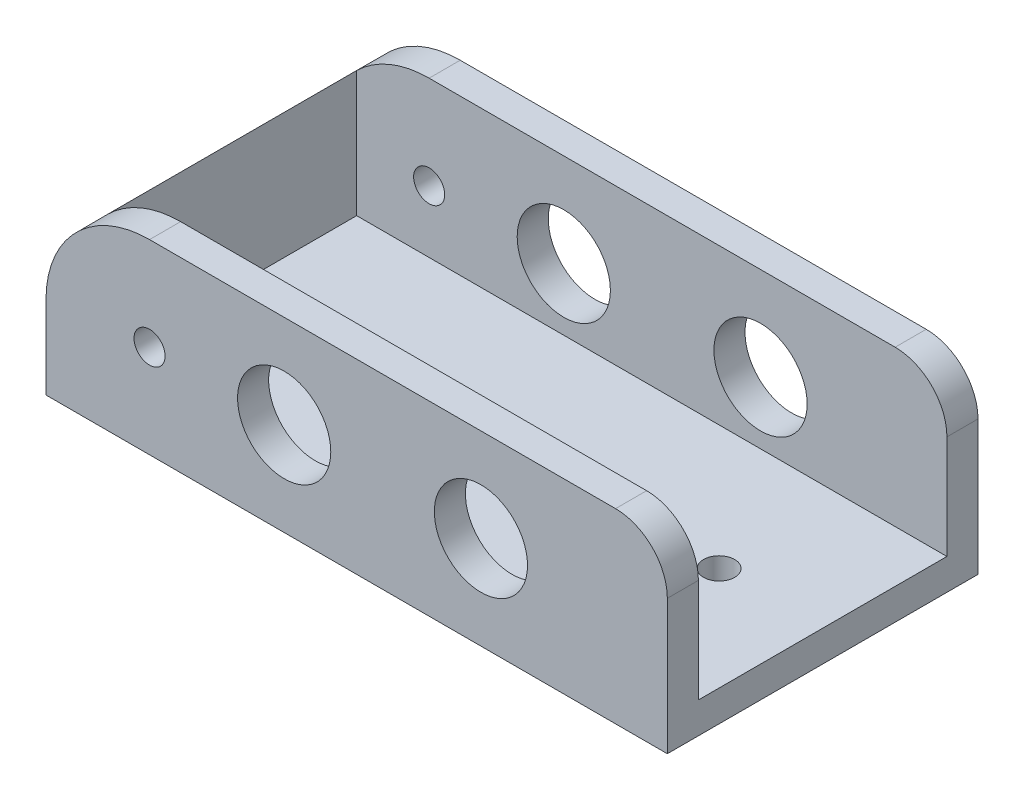
from build123d import *

# Parameters (mm, degrees)
CROQUIS1_W              = 60
CROQUIS1_H              = 30
CROQUIS1_R              = 1.5
SALIENTE_EXTRUIR1_DEPTH = 3
SALIENTE_EXTRUIR2_DEPTH = 15
REDONDEO1_R             = 10
REDONDEO2_R             = 5
CROQUIS3_R              = 4.5
CROQUIS3_R_2            = 1.5
CORTAR_EXTRUIR1_DEPTH   = 36


with BuildPart() as part:
    # Croquis1 → Saliente-Extruir1 (new body)
    with BuildSketch(Plane(origin=(0, 0, 0), x_dir=(1, 0, 0), z_dir=(0, 1, 0))):
        with Locations((30, 15)):
            Rectangle(CROQUIS1_W, CROQUIS1_H)
        with Locations(Location((10, 15, 0), (0, 0, 270))):
            Circle(CROQUIS1_R, mode=Mode.SUBTRACT)
        with Locations(Location((50, 15, 0), (0, 0, 270))):
            Circle(CROQUIS1_R, mode=Mode.SUBTRACT)
    extrude(amount=SALIENTE_EXTRUIR1_DEPTH)

    # Croquis2 → Saliente-Extruir2 (add)
    with BuildSketch(Plane(origin=(0, 3, 0), x_dir=(1, 0, 0), z_dir=(0, 1, 0))):
        Polygon((0, 30), (60, 30), (60, 27), (3, 27), (3, 3), (60, 3), (60, 0), (0, 0), align=None)
    extrude(amount=SALIENTE_EXTRUIR2_DEPTH)

    # Redondeo1
    # the kernel refuses this fillet: 10 mm, written as the material it takes off along each edge
    with BuildSketch(Plane(origin=(0, 18, 25), x_dir=(1, 0, 0), z_dir=(0, 0, -1))) as redondeo1_piece_1:
        with BuildLine():
            CenterArc((REDONDEO1_R, REDONDEO1_R), REDONDEO1_R, 180, 90)
            Line((0, REDONDEO1_R), (0, 0))
            Line((0, 0), (REDONDEO1_R, 0))
        make_face()
    extrude(amount=80, mode=Mode.SUBTRACT)

    # Redondeo2
    redondeo2_edges = [part.edges().sort_by_distance(p)[0] for p in [
        (60, 18, -1.5),
        (60, 18, -28.5),
    ]]
    fillet(redondeo2_edges, radius=REDONDEO2_R)

    # Croquis3 → Cortar-Extruir1 (cut)
    with BuildSketch(Plane.XY):
        with Locations((42, 9)):
            Circle(CROQUIS3_R)
        with Locations((23, 9)):
            Circle(CROQUIS3_R)
        with Locations((10, 9)):
            Circle(CROQUIS3_R_2)
    extrude(amount=-CORTAR_EXTRUIR1_DEPTH, mode=Mode.SUBTRACT)


solid = part.part
